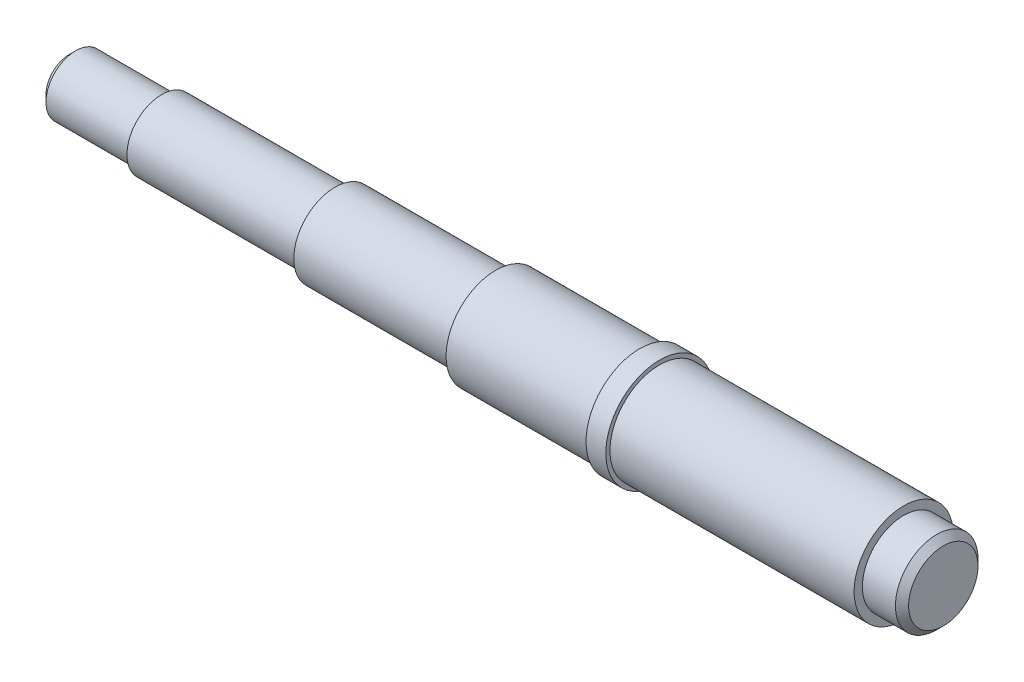
from build123d import *

# Parameters (mm, degrees)
CHAMFER_1_SIZE      = 2
CUT_EXTRUDE_START   = -11.5
SKETCH_2_W          = 18
SKETCH_2_H          = 8
CUT_EXTRUDE_1_DEPTH = 28


with BuildPart() as part:
    # 草图1 → 旋转1 (revolve)
    with BuildSketch(Plane.XY):
        Polygon((0, 0), (0, 9), (28, 9), (28, 10.5), (80.5, 10.5), (80.5, 12.5), (129.1, 12.5), (129.1, 15), (172.7, 15), (172.7, 16.25), (178.7, 16.25), (178.7, 15), (252.6, 15), (252.6, 12.5), (264.6, 12.5), (264.6, 0), align=None)
    revolve(axis=Axis((264.6, 0, 0), (-1, 0, 0)))

    # 倒角1
    chamfer_1_edges = [part.edges().sort_by_distance(p)[0] for p in [
        (264.6, -12.5, 0),
        (0, -9, 0),
    ]]
    chamfer(chamfer_1_edges, length=CHAMFER_1_SIZE)

    # 草图2 → 切除-拉伸1 (cut)
    with BuildSketch(Plane.XY.offset(CUT_EXTRUDE_START)):
        with Locations((150.9, 0)):
            Rectangle(SKETCH_2_W, SKETCH_2_H)
    extrude(amount=-CUT_EXTRUDE_1_DEPTH, mode=Mode.SUBTRACT)


solid = part.part
